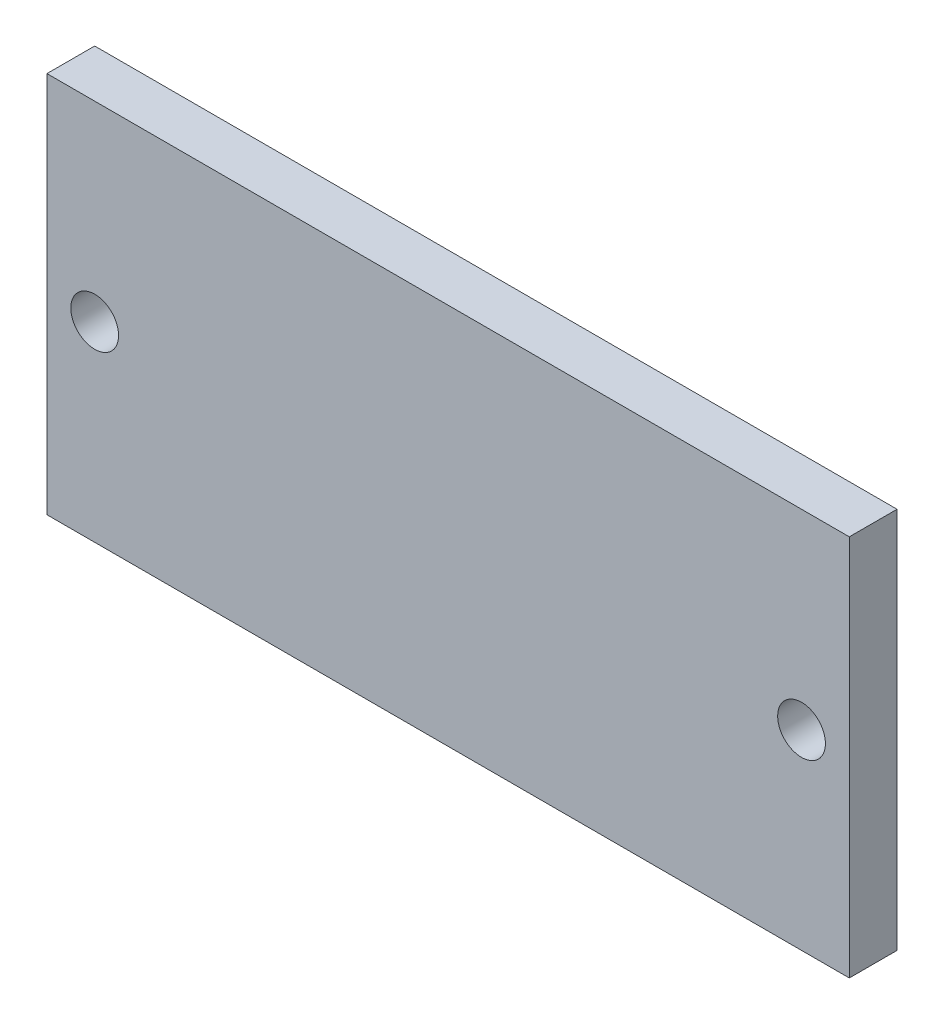
from build123d import *

# Parameters (mm, degrees)
SKETCH1_W           = 53.34
SKETCH1_H           = 25.4
SKETCH1_R           = 1.5875
BOSS_EXTRUDE1_DEPTH = 3.175


with BuildPart() as part:
    # Sketch1 → Boss-Extrude1 (new body)
    with BuildSketch(Plane.XY):
        Rectangle(SKETCH1_W, SKETCH1_H)
        with Locations((-23.495, 0)):
            Circle(SKETCH1_R, mode=Mode.SUBTRACT)
        with Locations((23.495, 0)):
            Circle(SKETCH1_R, mode=Mode.SUBTRACT)
    extrude(amount=BOSS_EXTRUDE1_DEPTH)


solid = part.part
